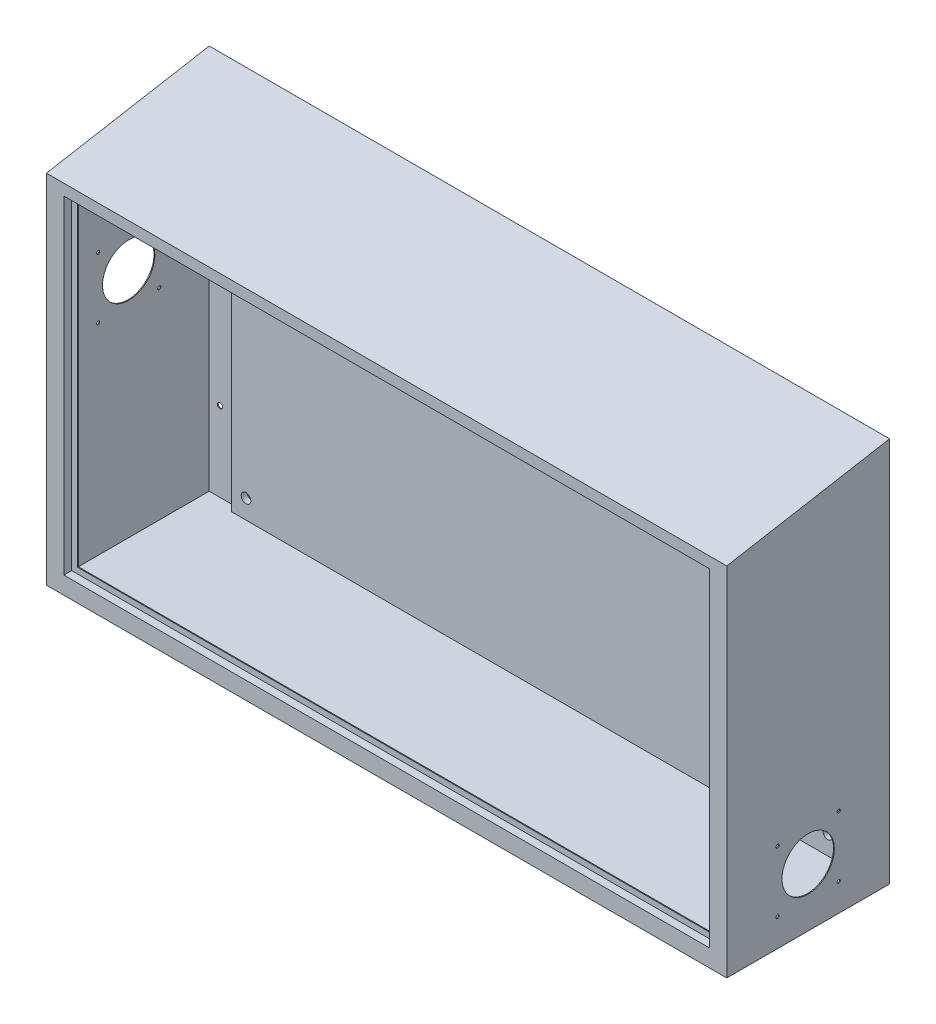
from build123d import *

# Parameters (mm, degrees)
SKETCH_1_W          = 1170
SKETCH_1_H          = 663
EXTRUDE_1_DEPTH     = 280
SKETCH_2_W          = 1110
SKETCH_2_H          = 564.628445402
CUT_EXTRUDE_1_DEPTH = 13.5
SKETCH_4_W          = 1090
SKETCH_4_H          = 544.628445402
CUT_EXTRUDE_2_DEPTH = 1.5
SHELL_START         = -583.5
SHELL_1_DEPTH       = 1167
SHELL_1_2_OUTLINE_W = 567.628445402
SHELL_1_2_OUTLINE_H = 13.5
SHELL_1_2_DEPTH     = 27
SHELL_START_2       = 556.5
SHELL_1_3_OUTLINE_W = 567.628445402
SHELL_1_3_OUTLINE_H = 13.5
SHELL_1_3_DEPTH     = 27
CUT_EXTRUDE_3_REACH = 730.366
SKETCH_5_R          = 4.5
CUT_EXTRUDE_4_REACH = 1249.875
SKETCH_6_R          = 45
SKETCH_6_R_2        = 2.75
CUT_EXTRUDE_6_REACH = 1249.875
SKETCH_8_R          = 45
SKETCH_8_R_2        = 2.75
SKETCH_9_W          = 1050
SKETCH_9_H          = 590
EXTRUDE_2_DEPTH     = 20
SKETCH_10_R         = 8.286870523
CUT_EXTRUDE_7_DEPTH = 10


# Read off the part's stored shape, not the designer's step: 抽壳1
with BuildPart() as part:
    # 草图1 → 凸台-拉伸1 (new body)
    with BuildSketch(Plane.XY):
        Rectangle(SKETCH_1_W, SKETCH_1_H)
    extrude(amount=EXTRUDE_1_DEPTH)

    # Split Bodies 1
    split(bisect_by=Plane(origin=(0, 321.504051895, 56.689838756), x_dir=(0, -0.17364817766691376, 0.984807753012211), z_dir=(0, 0.984807753012211, 0.17364817766691376)), keep=Keep.BOTTOM)

    # 草图2 → 切除-拉伸1 (cut)
    with BuildSketch(Plane.XY.offset(280)):
        with Locations((0, -19.185777299)):
            Rectangle(SKETCH_2_W, SKETCH_2_H)
    extrude(amount=-CUT_EXTRUDE_1_DEPTH, mode=Mode.SUBTRACT)

    # 草图4 → 切除-拉伸2 (cut)
    with BuildSketch(Plane.XY.offset(266.5)):
        with Locations((0, -19.185777299)):
            Rectangle(SKETCH_4_W, SKETCH_4_H)
    extrude(amount=-CUT_EXTRUDE_2_DEPTH, mode=Mode.SUBTRACT)

    # 抽壳1 outline → 抽壳1 (cut)
    with BuildSketch(Plane.YZ.offset(SHELL_START)):
        Polygon((-330, 1.5), (329.712369611, 1.5), (280.869795955, 278.5), (264.628445402, 278.5), (264.628445402, 265), (-303, 265), (-303, 278.5), (-330, 278.5), align=None)
    extrude(amount=SHELL_1_DEPTH, mode=Mode.SUBTRACT)

    # Shell 1 2 outline → Shell 1 2 (cut)
    with BuildSketch(Plane.YZ.offset(SHELL_START)):
        with Locations((-19.185777299, 271.75)):
            Rectangle(SHELL_1_2_OUTLINE_W, SHELL_1_2_OUTLINE_H)
    extrude(amount=SHELL_1_2_DEPTH, mode=Mode.SUBTRACT)

    # Shell 1 3 outline → Shell 1 3 (cut)
    with BuildSketch(Plane.YZ.offset(SHELL_START_2)):
        with Locations((-19.185777299, 271.75)):
            Rectangle(SHELL_1_3_OUTLINE_W, SHELL_1_3_OUTLINE_H)
    extrude(amount=SHELL_1_3_DEPTH, mode=Mode.SUBTRACT)

    # 草图5 → 切除-拉伸3 (cut, up to next)
    with BuildSketch(Plane(origin=(0, 0, 0), x_dir=(-1, 0, 0), z_dir=(0, 0, -1)), mode=Mode.PRIVATE) as cut_extrude_3_sk1:
        with Locations((-565, 256.5)):
            Circle(SKETCH_5_R)
    cut_extrude_3_tool1 = extrude(cut_extrude_3_sk1.sketch, amount=-CUT_EXTRUDE_3_REACH, mode=Mode.PRIVATE) & part.part
    # 草图5 → 切除-拉伸3 (cut, up to next)
    with BuildSketch(Plane(origin=(0, 0, 0), x_dir=(-1, 0, 0), z_dir=(0, 0, -1)), mode=Mode.PRIVATE) as cut_extrude_3_sk2:
        with Locations((-565, -193.5)):
            Circle(SKETCH_5_R)
    cut_extrude_3_tool2 = extrude(cut_extrude_3_sk2.sketch, amount=-CUT_EXTRUDE_3_REACH, mode=Mode.PRIVATE) & part.part
    # 草图5 → 切除-拉伸3 (cut, up to next)
    with BuildSketch(Plane(origin=(0, 0, 0), x_dir=(-1, 0, 0), z_dir=(0, 0, -1)), mode=Mode.PRIVATE) as cut_extrude_3_sk3:
        with Locations(Location((565, 256.5, 0), (0, 0, 180))):
            Circle(SKETCH_5_R)
    cut_extrude_3_tool3 = extrude(cut_extrude_3_sk3.sketch, amount=-CUT_EXTRUDE_3_REACH, mode=Mode.PRIVATE) & part.part
    # 草图5 → 切除-拉伸3 (cut, up to next)
    with BuildSketch(Plane(origin=(0, 0, 0), x_dir=(-1, 0, 0), z_dir=(0, 0, -1)), mode=Mode.PRIVATE) as cut_extrude_3_sk4:
        with Locations(Location((565, -193.5, 0), (0, 0, 180))):
            Circle(SKETCH_5_R)
    cut_extrude_3_tool4 = extrude(cut_extrude_3_sk4.sketch, amount=-CUT_EXTRUDE_3_REACH, mode=Mode.PRIVATE) & part.part
    # 草图5 → 切除-拉伸3 (cut, up to next)
    with BuildSketch(Plane(origin=(0, 0, 0), x_dir=(-1, 0, 0), z_dir=(0, 0, -1)), mode=Mode.PRIVATE) as cut_extrude_3_sk5:
        with BuildLine():
            Line((511.5, -196.5), (511.5, -226.5))
            ThreePointArc((511.5, -226.5), (526.5, -241.5), (541.5, -226.5))
            Line((541.5, -226.5), (541.5, -196.5))
            ThreePointArc((541.5, -196.5), (526.5, -181.5), (511.5, -196.5))
        make_face()
    cut_extrude_3_tool5 = extrude(cut_extrude_3_sk5.sketch, amount=-CUT_EXTRUDE_3_REACH, mode=Mode.PRIVATE) & part.part
    # 草图5 → 切除-拉伸3 (cut, up to next)
    with BuildSketch(Plane(origin=(0, 0, 0), x_dir=(-1, 0, 0), z_dir=(0, 0, -1)), mode=Mode.PRIVATE) as cut_extrude_3_sk6:
        with BuildLine():
            Line((526.5, 167.237), (526.5, 137.237))
            ThreePointArc((526.5, 137.237), (511.5, 122.237), (496.5, 137.237))
            Line((496.5, 137.237), (496.5, 167.237))
            ThreePointArc((496.5, 167.237), (511.5, 182.237), (526.5, 167.237))
        make_face()
    cut_extrude_3_tool6 = extrude(cut_extrude_3_sk6.sketch, amount=-CUT_EXTRUDE_3_REACH, mode=Mode.PRIVATE) & part.part
    # 草图5 → 切除-拉伸3 (cut, up to next)
    with BuildSketch(Plane(origin=(0, 0, 0), x_dir=(-1, 0, 0), z_dir=(0, 0, -1)), mode=Mode.PRIVATE) as cut_extrude_3_sk7:
        with BuildLine():
            Line((-541.5, -196.5), (-541.5, -226.5))
            ThreePointArc((-541.5, -226.5), (-526.5, -241.5), (-511.5, -226.5))
            Line((-511.5, -226.5), (-511.5, -196.5))
            ThreePointArc((-511.5, -196.5), (-526.5, -181.5), (-541.5, -196.5))
        make_face()
    cut_extrude_3_tool7 = extrude(cut_extrude_3_sk7.sketch, amount=-CUT_EXTRUDE_3_REACH, mode=Mode.PRIVATE) & part.part
    # 草图5 → 切除-拉伸3 (cut, up to next)
    with BuildSketch(Plane(origin=(0, 0, 0), x_dir=(-1, 0, 0), z_dir=(0, 0, -1)), mode=Mode.PRIVATE) as cut_extrude_3_sk8:
        with BuildLine():
            Line((-496.5, 167.237), (-496.5, 137.237))
            ThreePointArc((-496.5, 137.237), (-511.5, 122.237), (-526.5, 137.237))
            Line((-526.5, 137.237), (-526.5, 167.237))
            ThreePointArc((-526.5, 167.237), (-511.5, 182.237), (-496.5, 167.237))
        make_face()
    cut_extrude_3_tool8 = extrude(cut_extrude_3_sk8.sketch, amount=-CUT_EXTRUDE_3_REACH, mode=Mode.PRIVATE) & part.part
    add(cut_extrude_3_tool1.solids().sort_by_distance((565, 256.5, 0))[0], mode=Mode.SUBTRACT)
    add(cut_extrude_3_tool2.solids().sort_by_distance((565, -193.5, 0))[0], mode=Mode.SUBTRACT)
    add(cut_extrude_3_tool3.solids().sort_by_distance((-565, 256.5, 0))[0], mode=Mode.SUBTRACT)
    add(cut_extrude_3_tool4.solids().sort_by_distance((-565, -193.5, 0))[0], mode=Mode.SUBTRACT)
    add(cut_extrude_3_tool5.solids().sort_by_distance((-526.5, -211.5, 0))[0], mode=Mode.SUBTRACT)
    add(cut_extrude_3_tool6.solids().sort_by_distance((-511.5, 152.237, 0))[0], mode=Mode.SUBTRACT)
    add(cut_extrude_3_tool7.solids().sort_by_distance((526.5, -211.5, 0))[0], mode=Mode.SUBTRACT)
    add(cut_extrude_3_tool8.solids().sort_by_distance((511.5, 152.237, 0))[0], mode=Mode.SUBTRACT)

    # 草图6 → 切除-拉伸4 (cut, up to next)
    with BuildSketch(Plane(origin=(585, 0, 0), x_dir=(0, 0, -1), z_dir=(1, 0, 0)), mode=Mode.PRIVATE) as cut_extrude_4_sk1:
        with Locations((-140, -231.5)):
            Circle(SKETCH_6_R)
    cut_extrude_4_tool1 = extrude(cut_extrude_4_sk1.sketch, amount=-CUT_EXTRUDE_4_REACH, mode=Mode.PRIVATE) & part.part
    # 草图6 → 切除-拉伸4 (cut, up to next)
    with BuildSketch(Plane(origin=(585, 0, 0), x_dir=(0, 0, -1), z_dir=(1, 0, 0)), mode=Mode.PRIVATE) as cut_extrude_4_sk2:
        with Locations((-87.5, -179)):
            Circle(SKETCH_6_R_2)
    cut_extrude_4_tool2 = extrude(cut_extrude_4_sk2.sketch, amount=-CUT_EXTRUDE_4_REACH, mode=Mode.PRIVATE) & part.part
    # 草图6 → 切除-拉伸4 (cut, up to next)
    with BuildSketch(Plane(origin=(585, 0, 0), x_dir=(0, 0, -1), z_dir=(1, 0, 0)), mode=Mode.PRIVATE) as cut_extrude_4_sk3:
        with Locations(Location((-192.5, -179, 0), (0, 0, 180))):
            Circle(SKETCH_6_R_2)
    cut_extrude_4_tool3 = extrude(cut_extrude_4_sk3.sketch, amount=-CUT_EXTRUDE_4_REACH, mode=Mode.PRIVATE) & part.part
    # 草图6 → 切除-拉伸4 (cut, up to next)
    with BuildSketch(Plane(origin=(585, 0, 0), x_dir=(0, 0, -1), z_dir=(1, 0, 0)), mode=Mode.PRIVATE) as cut_extrude_4_sk4:
        with Locations((-192.5, -284)):
            Circle(SKETCH_6_R_2)
    cut_extrude_4_tool4 = extrude(cut_extrude_4_sk4.sketch, amount=-CUT_EXTRUDE_4_REACH, mode=Mode.PRIVATE) & part.part
    # 草图6 → 切除-拉伸4 (cut, up to next)
    with BuildSketch(Plane(origin=(585, 0, 0), x_dir=(0, 0, -1), z_dir=(1, 0, 0)), mode=Mode.PRIVATE) as cut_extrude_4_sk5:
        with Locations(Location((-87.5, -284, 0), (0, 0, 180))):
            Circle(SKETCH_6_R_2)
    cut_extrude_4_tool5 = extrude(cut_extrude_4_sk5.sketch, amount=-CUT_EXTRUDE_4_REACH, mode=Mode.PRIVATE) & part.part
    add(cut_extrude_4_tool1.solids().sort_by_distance((585, -231.5, 140))[0], mode=Mode.SUBTRACT)
    add(cut_extrude_4_tool2.solids().sort_by_distance((585, -179, 87.5))[0], mode=Mode.SUBTRACT)
    add(cut_extrude_4_tool3.solids().sort_by_distance((585, -179, 192.5))[0], mode=Mode.SUBTRACT)
    add(cut_extrude_4_tool4.solids().sort_by_distance((585, -284, 192.5))[0], mode=Mode.SUBTRACT)
    add(cut_extrude_4_tool5.solids().sort_by_distance((585, -284, 87.5))[0], mode=Mode.SUBTRACT)

    # 草图8 → 切除-拉伸6 (cut, up to next)
    with BuildSketch(Plane.ZY.offset(585), mode=Mode.PRIVATE) as cut_extrude_6_sk1:
        with Locations((140, 68.5)):
            Circle(SKETCH_8_R)
    cut_extrude_6_tool1 = extrude(cut_extrude_6_sk1.sketch, amount=-CUT_EXTRUDE_6_REACH, mode=Mode.PRIVATE) & part.part
    # 草图8 → 切除-拉伸6 (cut, up to next)
    with BuildSketch(Plane.ZY.offset(585), mode=Mode.PRIVATE) as cut_extrude_6_sk2:
        with Locations((192.5, 16)):
            Circle(SKETCH_8_R_2)
    cut_extrude_6_tool2 = extrude(cut_extrude_6_sk2.sketch, amount=-CUT_EXTRUDE_6_REACH, mode=Mode.PRIVATE) & part.part
    # 草图8 → 切除-拉伸6 (cut, up to next)
    with BuildSketch(Plane.ZY.offset(585), mode=Mode.PRIVATE) as cut_extrude_6_sk3:
        with Locations((87.5, 16)):
            Circle(SKETCH_8_R_2)
    cut_extrude_6_tool3 = extrude(cut_extrude_6_sk3.sketch, amount=-CUT_EXTRUDE_6_REACH, mode=Mode.PRIVATE) & part.part
    # 草图8 → 切除-拉伸6 (cut, up to next)
    with BuildSketch(Plane.ZY.offset(585), mode=Mode.PRIVATE) as cut_extrude_6_sk4:
        with Locations((87.5, 121)):
            Circle(SKETCH_8_R_2)
    cut_extrude_6_tool4 = extrude(cut_extrude_6_sk4.sketch, amount=-CUT_EXTRUDE_6_REACH, mode=Mode.PRIVATE) & part.part
    # 草图8 → 切除-拉伸6 (cut, up to next)
    with BuildSketch(Plane.ZY.offset(585), mode=Mode.PRIVATE) as cut_extrude_6_sk5:
        with Locations((192.5, 121)):
            Circle(SKETCH_8_R_2)
    cut_extrude_6_tool5 = extrude(cut_extrude_6_sk5.sketch, amount=-CUT_EXTRUDE_6_REACH, mode=Mode.PRIVATE) & part.part
    add(cut_extrude_6_tool1.solids().sort_by_distance((-585, 68.5, 140))[0], mode=Mode.SUBTRACT)
    add(cut_extrude_6_tool2.solids().sort_by_distance((-585, 16, 192.5))[0], mode=Mode.SUBTRACT)
    add(cut_extrude_6_tool3.solids().sort_by_distance((-585, 16, 87.5))[0], mode=Mode.SUBTRACT)
    add(cut_extrude_6_tool4.solids().sort_by_distance((-585, 121, 87.5))[0], mode=Mode.SUBTRACT)
    add(cut_extrude_6_tool5.solids().sort_by_distance((-585, 121, 192.5))[0], mode=Mode.SUBTRACT)

    # 草图9 → 凸台-拉伸2 (add)
    with BuildSketch(Plane.XY.offset(1.5)):
        with Locations((0, -26.5)):
            Rectangle(SKETCH_9_W, SKETCH_9_H)
    extrude(amount=EXTRUDE_2_DEPTH)

    # 草图10 → 切除-拉伸7 (cut)
    with BuildSketch(Plane.XY.offset(21.5)):
        with Locations((-500.232706652, 237.876964373)):
            Circle(SKETCH_10_R)
        with Locations(Location((500.232706652, 237.876964373, 0), (0, 0, 180))):
            Circle(SKETCH_10_R)
        with Locations((500.232706652, -288.753501232)):
            Circle(SKETCH_10_R)
        with Locations(Location((-500.232706652, -288.753501232, 0), (0, 0, 180))):
            Circle(SKETCH_10_R)
    extrude(amount=-CUT_EXTRUDE_7_DEPTH, mode=Mode.SUBTRACT)


solid = part.part
